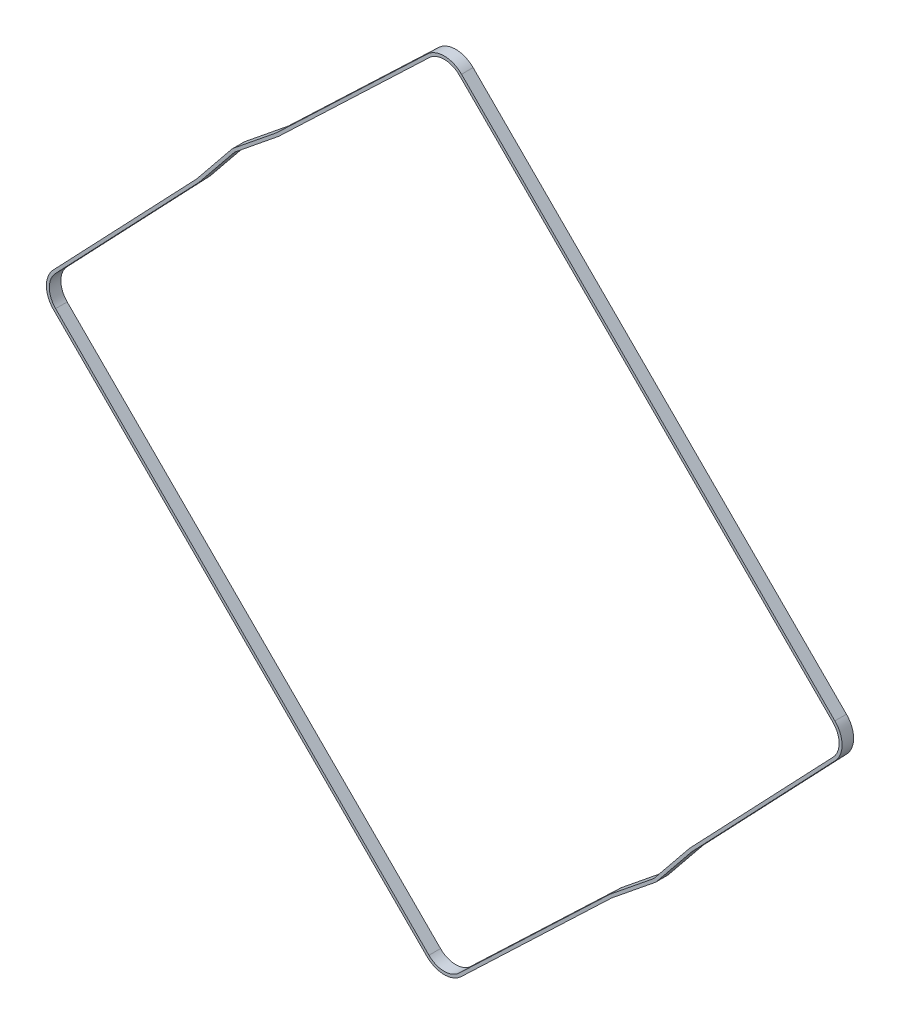
from build123d import *

# Parameters (mm, degrees)
EXTRUDE_THIN1_DEPTH = 6


with BuildPart() as part:
    # Sketch2 → Extrude-Thin1 (new body)
    with BuildSketch(Plane.XY):
        with BuildLine():
            Line((128.900495588, -280.799301945), (203.220141761, -202.783296005))
            ThreePointArc((203.220141761, -202.783296005), (206.733163198, -193.845540339), (203.004368462, -184.995631538))
            Line((203.004368462, -184.995631538), (9.004368462, 9.004368462))
            ThreePointArc((9.004368462, 9.004368462), (0.154459661, 12.733163198), (-8.783296005, 9.220141761))
            Line((-8.783296005, 9.220141761), (-86.799301945, -65.099504412))
            ThreePointArc((-86.799301945, -65.099504412), (-87.08073211, -65.357001238), (-87.372293459, -65.602967767))
            Line((-87.372293459, -65.602967767), (-109.46240239, -83.490412558))
            ThreePointArc((-109.46240239, -83.490412558), (-110.013440784, -83.986559216), (-110.509587442, -84.53759761))
            Line((-110.509587442, -84.53759761), (-128.397032233, -106.627706541))
            ThreePointArc((-128.397032233, -106.627706541), (-128.642998762, -106.91926789), (-128.900495588, -107.200698055))
            Line((-128.900495588, -107.200698055), (-203.220141761, -185.216703995))
            ThreePointArc((-203.220141761, -185.216703995), (-206.733163198, -194.154459661), (-203.004368462, -203.004368462))
            Line((-203.004368462, -203.004368462), (-9.004368462, -397.004368462))
            ThreePointArc((-9.004368462, -397.004368462), (-0.154459661, -400.733163198), (8.783296005, -397.220141761))
            Line((8.783296005, -397.220141761), (86.799301945, -322.900495588))
            ThreePointArc((86.799301945, -322.900495588), (87.08073211, -322.642998762), (87.372293459, -322.397032234))
            Line((87.372293459, -322.397032233), (109.46240239, -304.509587442))
            ThreePointArc((109.46240239, -304.509587442), (110.013440784, -304.013440784), (110.509587442, -303.46240239))
            Line((110.509587442, -303.46240239), (128.397032233, -281.372293459))
            ThreePointArc((128.397032233, -281.372293459), (128.642998762, -281.08073211), (128.900495588, -280.799301945))
        make_face()
        with BuildLine():
            Line((127.7999376, -279.75088785), (202.119583773, -201.73488191))
            ThreePointArc((202.119583773, -201.73488191), (205.213275019, -193.863977345), (201.929566155, -186.070433845))
            Line((201.929566155, -186.070433845), (7.929566155, 7.929566155))
            ThreePointArc((7.929566155, 7.929566155), (0.136022655, 11.213275019), (-7.73488191, 8.119583773))
            Line((-7.73488191, 8.119583773), (-85.75088785, -66.2000624))
            ThreePointArc((-85.75088785, -66.2000624), (-86.077441838, -66.498845637), (-86.415751421, -66.784249837))
            Line((-86.415751421, -66.784249837), (-108.505860352, -84.671694628))
            ThreePointArc((-108.505860352, -84.671694628), (-108.938638477, -85.061361523), (-109.328305372, -85.494139648))
            Line((-109.328305372, -85.494139648), (-127.215750163, -107.584248579))
            ThreePointArc((-127.215750163, -107.584248579), (-127.501154363, -107.922558162), (-127.7999376, -108.24911215))
            Line((-127.7999376, -108.24911215), (-202.119583773, -186.26511809))
            ThreePointArc((-202.119583773, -186.26511809), (-205.213275019, -194.136022655), (-201.929566155, -201.929566155))
            Line((-201.929566155, -201.929566155), (-7.929566155, -395.929566155))
            ThreePointArc((-7.929566155, -395.929566155), (-0.136022654, -399.213275019), (7.73488191, -396.119583773))
            Line((7.73488191, -396.119583773), (85.75088785, -321.7999376))
            ThreePointArc((85.75088785, -321.7999376), (86.077441838, -321.501154363), (86.415751421, -321.215750163))
            Line((86.415751421, -321.215750163), (108.505860352, -303.328305372))
            ThreePointArc((108.505860352, -303.328305372), (108.938638477, -302.938638477), (109.328305372, -302.505860352))
            Line((109.328305372, -302.505860352), (127.215750163, -280.415751421))
            ThreePointArc((127.215750163, -280.415751421), (127.501154363, -280.077441838), (127.7999376, -279.75088785))
        make_face(mode=Mode.SUBTRACT)
    extrude(amount=EXTRUDE_THIN1_DEPTH)


solid = part.part
